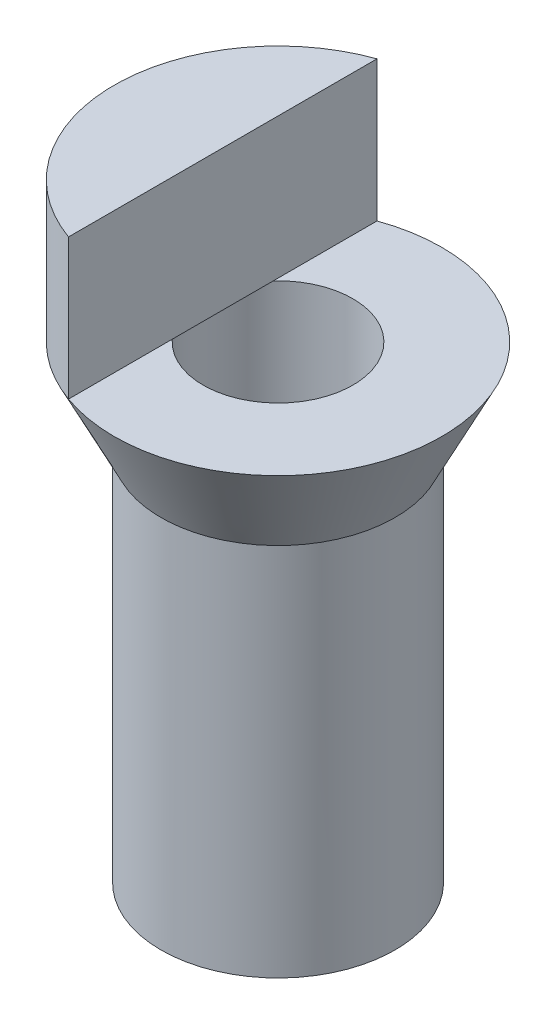
from build123d import *

# Parameters (mm, degrees)
SKETCH2_R           = 6.25
SKETCH2_R_2         = 4
BOSS_EXTRUDE1_DEPTH = 25
BOSS_EXTRUDE2_DEPTH = 7.5


# Read off the part's stored shape, not the designer's step: Surface-Imported1
with BuildPart() as part:
    # Sketch2 → Boss-Extrude1 (new body)
    with BuildSketch(Plane.XZ.offset(28.000000864)):
        with Locations(Location((33.049998865, 28.000002976, 0), (0, 0, 270))):
            Circle(SKETCH2_R)
        with Locations(Location((33.049998865, 28.000002976, 0), (0, 0, 270))):
            Circle(SKETCH2_R_2, mode=Mode.SUBTRACT)
    extrude(amount=BOSS_EXTRUDE1_DEPTH)

    # Sketch7 → Revolve1 (revolve)
    with BuildSketch(Plane.XY.offset(28.000002976), mode=Mode.PRIVATE) as revolve1_sk:
        Polygon((26.799998865, -33.000000864), (24.299998865, -28.000000864), (26.799998865, -28.000000864), align=None)
    revolve(revolve1_sk.sketch.rotate(Axis((33.049998865, -53.000000864, 28.000002976), (0, 1, 0)), 270), axis=Axis((33.049998865, -53.000000864, 28.000002976), (0, 1, 0)))

    # Sketch4 → Boss-Extrude2 (add)
    with BuildSketch(Plane(origin=(0, -28.000000864, 0), x_dir=(1, 0, 0), z_dir=(0, 1, 0))):
        with BuildLine():
            Line((35.99999845, -19.762284697), (35.99999845, -36.237721255))
            ThreePointArc((35.99999845, -36.237721255), (41.799998865, -28.000002976), (35.99999845, -19.762284697))
        make_face()
    extrude(amount=BOSS_EXTRUDE2_DEPTH)


with BuildPart() as body_2:
    # Mirror2: mirrored copy
    add(part.part.mirror(Plane(origin=(10.999999009, 0, 0), x_dir=(0, 0, 1), z_dir=(1, 0, 0))))


solid = body_2.part
